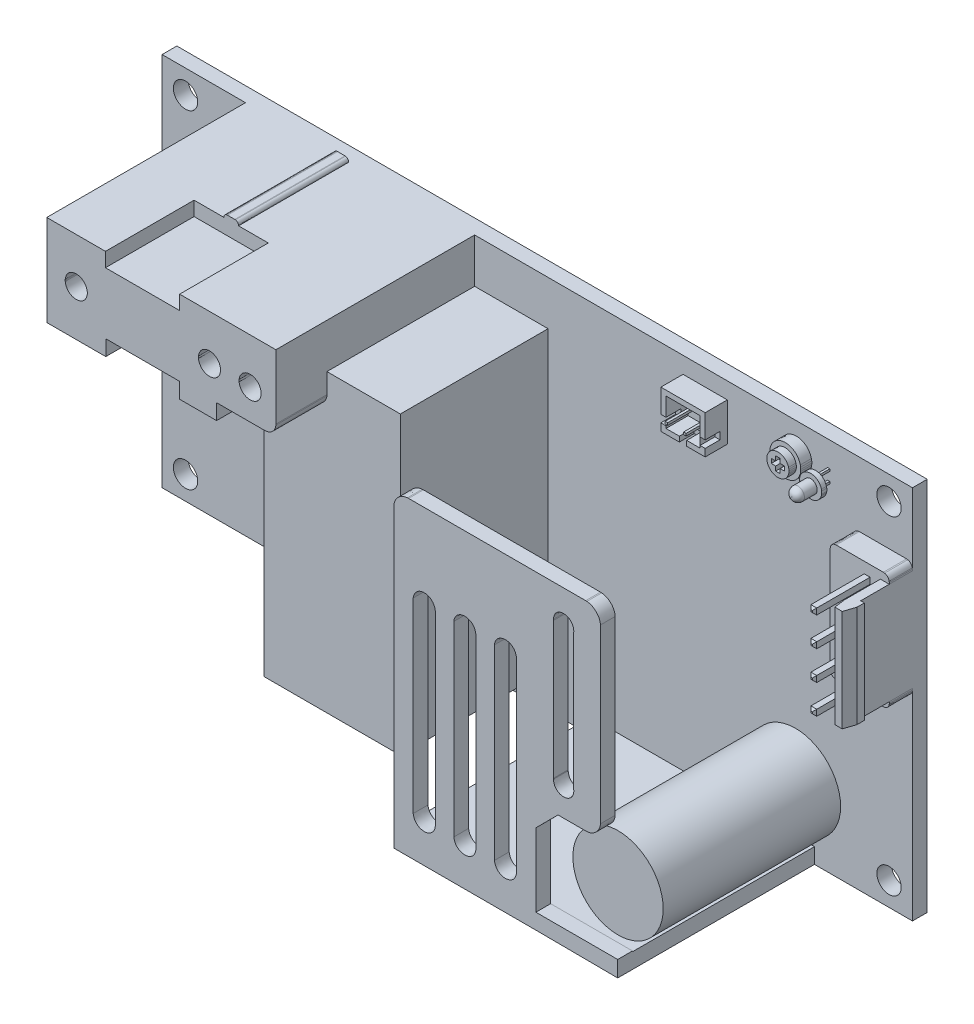
from build123d import *

# Parameters (mm, degrees)
MODEL_W            = 101.6
MODEL_H            = 50.8
MODEL_R            = 1.65
EXTRUDE_951_DEPTH  = 2
EXTRUDE_3496_DEPTH = 8
EXTRUDE_1_DEPTH    = 1.5
EXTRUDE_2_DEPTH    = 2.5
EXTRUDE_START      = 1.76
EXTRUDE_1_2_DEPTH  = 0.68
SKETCH14_W         = 0.3
SKETCH14_H         = 0.3
EXTRUDE_4126_DEPTH = 6.02
SKETCH15_R         = 0.885
EXTRUDE_2_2_DEPTH  = 2.56
FILLET_3_R         = 0.83
CN1_DEPTH          = 3.27
SKETCH16_W         = 0.788697824
SKETCH16_H         = 0.829064995
SKETCH16_H_2       = 0.828989046
CN1_2_DEPTH        = 10.8
CN1_3_DEPTH        = 9.818754362
CN1_45_SIZE        = 0.3
CN2_DEPTH          = 3.14
SKETCH18_W         = 0.788811748
SKETCH18_H         = 0.828951071
SKETCH18_H_2       = 0.829064995
SKETCH18_H_3       = 0.82910297
CN2_2_DEPTH        = 10.66
CN2_45_SIZE        = 0.3
CN2_3_DEPTH        = 13.77610427
CN101_DEPTH        = 3
SKETCH20_W         = 0.334227269
SKETCH20_H         = 0.318000654
SKETCH20_W_2       = 0.334250054
CN101_2_DEPTH      = 4
SKETCH22_W         = 0.693798895
SKETCH22_H         = 0.992660269
SKETCH22_W_2       = 0.993040016
SKETCH22_H_2       = 0.693419147
SKETCH22_W_3       = 0.693419147
CN101_2_2_DEPTH    = 2
HS1_DEPTH          = 26.91
HS12_W             = 10.041048365
HS12_H             = 3.207380154
HS12_W_2           = 9.999514227
HS12_H_2           = 2.100384065
HS1_2_DEPTH        = 12
EXTRUDE19_DEPTH    = 26.64
SKETCH24_W         = 35.128538906
SKETCH24_H         = 24.64
EXTRUDE20_DEPTH    = 40
SKETCH10_R         = 6.116837053
EXTRUDE_7326_DEPTH = 24.02
EXTRUDE22_DEPTH    = 20


with BuildPart() as part:
    # Model → Extrude 951 (new body)
    with BuildSketch(Plane.XY):
        with Locations((50.8, 25.4)):
            Rectangle(MODEL_W, MODEL_H)
        with Locations((3.175, 47.625)):
            Circle(MODEL_R, mode=Mode.SUBTRACT)
        with Locations((3.175, 3.175)):
            Circle(MODEL_R, mode=Mode.SUBTRACT)
        with Locations((98.425, 3.175)):
            Circle(MODEL_R, mode=Mode.SUBTRACT)
        with Locations((98.425, 47.625)):
            Circle(MODEL_R, mode=Mode.SUBTRACT)
    extrude(amount=-EXTRUDE_951_DEPTH)

    # Sketch3 → Extrude 3496 (add)
    with BuildSketch(Plane.XY):
        with BuildLine():
            add(Edge.make_bspline(
                [(13.62154699, 24.750430627), (13.616990018, 24.750430627), (13.612433047, 24.750430627), (13.607876076, 24.750430627), (12.112050216, 24.750430627), (10.616224356, 24.750430627), (9.120398496, 24.750430627)],
                knots=[10, 10, 10, 10, 11, 11, 11, 12, 12, 12, 12], degree=3, weights=[1, 1, 1, 1, 1, 1, 1]))
            add(Edge.make_bspline(
                [(9.120398496, 24.750430627), (9.115841525, 24.750430627), (9.111284553, 24.750430627), (9.106727582, 24.750430627)],
                knots=[0, 0, 0, 0, 1, 1, 1, 1], degree=3, weights=[1, 1, 1, 1]))
            add(Edge.make_bspline(
                [(9.106727582, 24.750430627), (9.106727582, 24.754987599), (9.106727582, 24.75954457), (9.106727582, 24.764101542), (9.106727582, 27.588284563), (9.106727582, 30.412467584), (9.106727582, 33.236650605), (9.106727582, 33.245637965), (9.106727582, 33.254625325), (9.106727582, 33.263612685)],
                knots=[1, 1, 1, 1, 2, 2, 2, 3, 3, 3, 4, 4, 4, 4], degree=3, weights=[1, 1, 1, 1, 1, 1, 1, 1, 1, 1]))
            add(Edge.make_bspline(
                [(9.106727582, 33.263612685), (9.111284553, 33.263612685), (9.115841525, 33.263612685), (9.120398496, 33.263612685), (10.616224356, 33.263612685), (12.112050216, 33.263612685), (13.607876076, 33.263612685), (13.612433047, 33.263612685), (13.616990018, 33.263612685), (13.62154699, 33.263612685)],
                knots=[4, 4, 4, 4, 5, 5, 5, 6, 6, 6, 7, 7, 7, 7], degree=3, weights=[1, 1, 1, 1, 1, 1, 1, 1, 1, 1]))
            add(Edge.make_bspline(
                [(13.62154699, 33.263612685), (13.62154699, 33.254625325), (13.62154699, 33.245637965), (13.62154699, 33.236650605), (13.62154699, 30.412467584), (13.62154699, 27.588284563), (13.62154699, 24.764101542), (13.62154699, 24.75954457), (13.62154699, 24.754987599), (13.62154699, 24.750430627)],
                knots=[7, 7, 7, 7, 8, 8, 8, 9, 9, 9, 10, 10, 10, 10], degree=3, weights=[1, 1, 1, 1, 1, 1, 1, 1, 1, 1]))
        make_face()
        with BuildLine():
            add(Edge.make_bspline(
                [(0.231266298, 22.616249025), (0.239873911, 22.616249025), (0.248861271, 22.616249025), (0.257848631, 22.616249025), (3.082031652, 22.616249025), (5.906214673, 22.616249025), (8.730397694, 22.616249025), (8.734954666, 22.616249025), (8.739511637, 22.616249025), (8.744448356, 22.616249025)],
                knots=[0, 0, 0, 0, 1, 1, 1, 2, 2, 2, 3, 3, 3, 3], degree=3, weights=[1, 1, 1, 1, 1, 1, 1, 1, 1, 1]))
            add(Edge.make_bspline(
                [(8.744448356, 27.130688685), (8.744448356, 27.126131714), (8.744448356, 27.121574742), (8.744448356, 27.117017771), (8.744448356, 25.621191911), (8.744448356, 24.125366051), (8.744448356, 22.629540191), (8.744448356, 22.62498322), (8.744448356, 22.620426249), (8.744448356, 22.616249025)],
                knots=[6, 6, 6, 6, 7, 7, 7, 8, 8, 8, 9, 9, 9, 9], degree=3, weights=[1, 1, 1, 1, 1, 1, 1, 1, 1, 1]))
            add(Edge.make_bspline(
                [(0.231266298, 27.130688685), (0.240253658, 27.130688685), (0.249241019, 27.130688685), (0.258228379, 27.130688685), (3.0824114, 27.130688685), (5.906594421, 27.130688685), (8.730777442, 27.130688685), (8.735334413, 27.130688685), (8.739891385, 27.130688685), (8.744448356, 27.130688685)],
                knots=[3, 3, 3, 3, 4, 4, 4, 5, 5, 5, 6, 6, 6, 6], degree=3, weights=[1, 1, 1, 1, 1, 1, 1, 1, 1, 1]))
            add(Edge.make_bspline(
                [(0.231266298, 22.616249025), (0.231266298, 22.620426249), (0.231266298, 22.62498322), (0.231266298, 22.629540191), (0.231266298, 24.125366051), (0.231266298, 25.621191911), (0.231266298, 27.117017771), (0.231266298, 27.121574742), (0.231266298, 27.126131714), (0.231266298, 27.130688685)],
                knots=[0, 0, 0, 0, 1, 1, 1, 2, 2, 2, 3, 3, 3, 3], degree=3, weights=[1, 1, 1, 1, 1, 1, 1, 1, 1, 1]))
        make_face()
    extrude(amount=EXTRUDE_3496_DEPTH)

    # Sketch13 → Extrude 1 (add)
    with BuildSketch(Plane.XY):
        with BuildLine():
            add(Edge.make_bspline(
                [(87.960180824, 47.149084268), (87.946636492, 47.230603423), (87.93309216, 47.312122578), (87.919547829, 47.393641733)],
                knots=[7, 7, 7, 7, 8, 8, 8, 8], degree=3, weights=[1, 1, 1, 1]))
            add(Edge.make_bspline(
                [(87.919547829, 47.393641733), (87.298280729, 49.655798282), (84.141059049, 49.468962455), (83.798906446, 47.149084268)],
                knots=[0, 0, 0, 0, 1, 1, 1, 1], degree=3, weights=[1, 1, 1, 1]))
            add(Edge.make_bspline(
                [(83.798906446, 47.149084268), (83.794349475, 47.062881559), (83.789792504, 46.976678851), (83.785235532, 46.890476142)],
                knots=[1, 1, 1, 1, 2, 2, 2, 2], degree=3, weights=[1, 1, 1, 1]))
            add(Edge.make_bspline(
                [(83.785235532, 46.890476142), (83.789792504, 46.808956987), (83.794349475, 46.727437832), (83.798906446, 46.645918677)],
                knots=[2, 2, 2, 2, 3, 3, 3, 3], degree=3, weights=[1, 1, 1, 1]))
            add(Edge.make_bspline(
                [(83.798906446, 46.645918677), (84.106122268, 44.327559481), (87.315369372, 44.133128701), (87.919547829, 46.38731055)],
                knots=[3, 3, 3, 3, 4, 4, 4, 4], degree=3, weights=[1, 1, 1, 1]))
            add(Edge.make_bspline(
                [(87.919547829, 46.38731055), (87.93309216, 46.473513259), (87.946636492, 46.559715968), (87.960180824, 46.645918677)],
                knots=[4, 4, 4, 4, 5, 5, 5, 5], degree=3, weights=[1, 1, 1, 1]))
            add(Edge.make_bspline(
                [(87.960180824, 46.645918677), (87.964737795, 46.727437832), (87.969294767, 46.808956987), (87.973851738, 46.890476142)],
                knots=[5, 5, 5, 5, 6, 6, 6, 6], degree=3, weights=[1, 1, 1, 1]))
            add(Edge.make_bspline(
                [(87.973851738, 46.890476142), (87.969294767, 46.976678851), (87.964737795, 47.062881559), (87.960180824, 47.149084268)],
                knots=[6, 6, 6, 6, 7, 7, 7, 7], degree=3, weights=[1, 1, 1, 1]))
        make_face()
    extrude(amount=EXTRUDE_1_DEPTH)

    # Sketch7 → Extrude 2 (add)
    with BuildSketch(Plane.XY):
        with BuildLine():
            add(Edge.make_bspline(
                [(87.362078328, 47.108071526), (87.348533997, 47.176046349), (87.334989665, 47.244021172), (87.321445333, 47.311995996)],
                knots=[7, 7, 7, 7, 8, 8, 8, 8], degree=3, weights=[1, 1, 1, 1]))
            add(Edge.make_bspline(
                [(87.321445333, 47.311995996), (86.822077218, 48.857948541), (84.670806973, 48.706429242), (84.397388689, 47.108071526)],
                knots=[0, 0, 0, 0, 1, 1, 1, 1], degree=3, weights=[1, 1, 1, 1]))
            add(Edge.make_bspline(
                [(84.397388689, 47.108071526), (84.392958301, 47.035539731), (84.388527912, 46.963007936), (84.384097523, 46.890476142)],
                knots=[1, 1, 1, 1, 2, 2, 2, 2], degree=3, weights=[1, 1, 1, 1]))
            add(Edge.make_bspline(
                [(84.384097523, 46.890476142), (84.388527912, 46.817944347), (84.392958301, 46.745412552), (84.397388689, 46.672880758)],
                knots=[2, 2, 2, 2, 3, 3, 3, 3], degree=3, weights=[1, 1, 1, 1]))
            add(Edge.make_bspline(
                [(84.397388689, 46.672880758), (84.672325963, 45.080978751), (86.820558228, 44.931737938), (87.321445333, 46.468956288)],
                knots=[3, 3, 3, 3, 4, 4, 4, 4], degree=3, weights=[1, 1, 1, 1]))
            add(Edge.make_bspline(
                [(87.321445333, 46.468956288), (87.334989665, 46.536931111), (87.348533997, 46.604905934), (87.362078328, 46.672880758)],
                knots=[4, 4, 4, 4, 5, 5, 5, 5], degree=3, weights=[1, 1, 1, 1]))
            add(Edge.make_bspline(
                [(87.362078328, 46.672880758), (87.3666353, 46.745412552), (87.371192271, 46.817944347), (87.375749243, 46.890476142)],
                knots=[5, 5, 5, 5, 6, 6, 6, 6], degree=3, weights=[1, 1, 1, 1]))
            add(Edge.make_bspline(
                [(87.375749243, 46.890476142), (87.371192271, 46.963007936), (87.3666353, 47.035539731), (87.362078328, 47.108071526)],
                knots=[6, 6, 6, 6, 7, 7, 7, 7], degree=3, weights=[1, 1, 1, 1]))
        make_face()
        Polygon((85.580682261, 47.787819759), (85.580682261, 47.189337516), (84.982200018, 47.189337516), (84.982200018, 46.59123502), (85.580682261, 46.59123502), (85.580682261, 45.992752777), (86.179164504, 45.992752777), (86.179164504, 46.59123502), (86.777267, 46.59123502), (86.777267, 47.189337516), (86.179164504, 47.189337516), (86.179164504, 47.787819759), align=None, mode=Mode.SUBTRACT)
    extrude(amount=EXTRUDE_2_DEPTH)



with BuildPart() as body_2:
    # Sketch8 → Extrude 1 2 (new body)
    with BuildSketch(Plane.XY.offset(EXTRUDE_START)):
        with BuildLine():
            add(Edge.make_bspline(
                [(91.754619004, 46.346297808), (91.74094809, 46.282753373), (91.727277176, 46.219208939), (91.713606261, 46.155664505)],
                knots=[7, 7, 7, 7, 8, 8, 8, 8], degree=3, weights=[1, 1, 1, 1]))
            add(Edge.make_bspline(
                [(91.713606261, 46.155664505), (91.180820356, 44.394395061), (88.708283627, 44.828446586), (88.762587537, 46.618197101)],
                knots=[0, 0, 0, 0, 1, 1, 1, 1], degree=3, weights=[1, 1, 1, 1]))
            add(Edge.make_bspline(
                [(88.762587537, 46.618197101), (88.767144508, 46.677184564), (88.771701479, 46.736172027), (88.776258451, 46.79515949)],
                knots=[1, 1, 1, 1, 2, 2, 2, 2], degree=3, weights=[1, 1, 1, 1]))
            add(Edge.make_bspline(
                [(88.776258451, 46.79515949), (88.789929365, 46.858577342), (88.803600279, 46.921995194), (88.817271193, 46.985413046)],
                knots=[2, 2, 2, 2, 3, 3, 3, 3], degree=3, weights=[1, 1, 1, 1]))
            add(Edge.make_bspline(
                [(88.817271193, 46.985413046), (89.339424165, 48.42959323), (91.297402874, 48.368453864), (91.713606261, 46.903767308)],
                knots=[3, 3, 3, 3, 4, 4, 4, 4], degree=3, weights=[1, 1, 1, 1]))
            add(Edge.make_bspline(
                [(91.713606261, 46.903767308), (91.727277176, 46.844779845), (91.74094809, 46.785792382), (91.754619004, 46.726804919)],
                knots=[4, 4, 4, 4, 5, 5, 5, 5], degree=3, weights=[1, 1, 1, 1]))
            add(Edge.make_bspline(
                [(91.754619004, 46.726804919), (91.754619004, 46.663387067), (91.754619004, 46.599969215), (91.754619004, 46.536551364), (91.754619004, 46.473133512), (91.754619004, 46.40971566), (91.754619004, 46.346297808)],
                knots=[5, 5, 5, 5, 6, 6, 6, 7, 7, 7, 7], degree=3, weights=[1, 1, 1, 1, 1, 1, 1]))
        make_face()
    extrude(amount=EXTRUDE_1_2_DEPTH)


with BuildPart() as part_1:
    add(part.part)

    add(body_2.part)  # Extrude 4126 merges body 2
    # Sketch14 → Extrude 4126 (add)
    with BuildSketch(Plane.XY.offset(2.44)):
        with Locations((90.258239122, 47.276551364)):
            Rectangle(SKETCH14_W, SKETCH14_H)
        with Locations((90.258239122, 45.796551364)):
            Rectangle(SKETCH14_W, SKETCH14_H)
    extrude(amount=-EXTRUDE_4126_DEPTH)

    # Sketch15 → Extrude 2 2 (add)
    with BuildSketch(Plane.XY.offset(2.44)):
        with Locations(Location((90.258239122, 46.536551364, 0), (0, 0, 180))):
            Circle(SKETCH15_R)
    extrude(amount=EXTRUDE_2_2_DEPTH)

    # светодиод-3
    fillet_3_edges = [part_1.edges().sort_by_distance(p)[0] for p in [
        (91.143239122, 46.536551364, 5),
    ]]
    fillet(fillet_3_edges, radius=FILLET_3_R)

    # Sketch2 → CN1 (add)
    with BuildSketch(Plane.XY):
        with BuildLine():
            Line((0.000379748, 28.816768101), (1.196964486, 28.816768101))
            Line((1.196964486, 28.816768101), (1.196964486, 38.635522463))
            Line((1.196964486, 38.635522463), (0.000379748, 38.635522463))
            Line((0.000379748, 38.635522463), (0.000379748, 38.825776018))
            add(Edge.make_bspline(
                [(0.014050662, 38.989067493), (0.00949369, 38.934637002), (0.004936719, 38.88020651), (0.000379748, 38.825776018)],
                knots=[9, 9, 9, 9, 10, 10, 10, 10], degree=3, weights=[1, 1, 1, 1]))
            add(Edge.make_bspline(
                [(0.639494986, 39.614511817), (0.35050705, 39.573878822), (0.054683657, 39.278055429), (0.014050662, 38.989067493)],
                knots=[8, 8, 8, 8, 9, 9, 9, 9], degree=3, weights=[1, 1, 1, 1]))
            add(Edge.make_bspline(
                [(0.80278646, 39.628182731), (0.748355969, 39.62362576), (0.693925477, 39.619068788), (0.639494986, 39.614511817)],
                knots=[7, 7, 7, 7, 8, 8, 8, 8], degree=3, weights=[1, 1, 1, 1]))
            add(Edge.make_bspline(
                [(7.194318587, 39.628182731), (5.063807878, 39.628182731), (2.933297169, 39.628182731), (0.80278646, 39.628182731)],
                knots=[6, 6, 6, 6, 7, 7, 7, 7], degree=3, weights=[1, 1, 1, 1]))
            add(Edge.make_bspline(
                [(7.357610062, 39.614511817), (7.30317957, 39.619068788), (7.248749079, 39.62362576), (7.194318587, 39.628182731)],
                knots=[5, 5, 5, 5, 6, 6, 6, 6], degree=3, weights=[1, 1, 1, 1]))
            add(Edge.make_bspline(
                [(7.983054386, 38.989067493), (7.942041643, 39.277675682), (7.646597998, 39.57425857), (7.357610062, 39.614511817)],
                knots=[4, 4, 4, 4, 5, 5, 5, 5], degree=3, weights=[1, 1, 1, 1]))
            add(Edge.make_bspline(
                [(7.9967253, 38.825776018), (7.992168329, 38.88020651), (7.987611357, 38.934637002), (7.983054386, 38.989067493)],
                knots=[3, 3, 3, 3, 4, 4, 4, 4], degree=3, weights=[1, 1, 1, 1]))
            add(Edge.make_bspline(
                [(7.9967253, 28.626514545), (7.9967253, 32.02626837), (7.9967253, 35.426022194), (7.9967253, 38.825776018)],
                knots=[2, 2, 2, 2, 3, 3, 3, 3], degree=3, weights=[1, 1, 1, 1]))
            add(Edge.make_bspline(
                [(7.983054386, 28.46322307), (7.987611357, 28.517653562), (7.992168329, 28.572084053), (7.9967253, 28.626514545)],
                knots=[1, 1, 1, 1, 2, 2, 2, 2], degree=3, weights=[1, 1, 1, 1]))
            add(Edge.make_bspline(
                [(7.357610062, 27.837778746), (7.646597998, 27.878411741), (7.942041643, 28.174235134), (7.983054386, 28.46322307)],
                knots=[0, 0, 0, 0, 1, 1, 1, 1], degree=3, weights=[1, 1, 1, 1]))
            add(Edge.make_bspline(
                [(7.194318587, 27.824107832), (7.248749079, 27.828664804), (7.30317957, 27.833221775), (7.357610062, 27.837778746)],
                knots=[15, 15, 15, 15, 16, 16, 16, 16], degree=3, weights=[1, 1, 1, 1]))
            add(Edge.make_bspline(
                [(0.80278646, 27.824107832), (2.933297169, 27.824107832), (5.063807878, 27.824107832), (7.194318587, 27.824107832)],
                knots=[14, 14, 14, 14, 15, 15, 15, 15], degree=3, weights=[1, 1, 1, 1]))
            add(Edge.make_bspline(
                [(0.639494986, 27.837778746), (0.693925477, 27.833221775), (0.748355969, 27.828664804), (0.80278646, 27.824107832)],
                knots=[13, 13, 13, 13, 14, 14, 14, 14], degree=3, weights=[1, 1, 1, 1]))
            add(Edge.make_bspline(
                [(0.014050662, 28.46322307), (0.054683657, 28.174235134), (0.35050705, 27.878411741), (0.639494986, 27.837778746)],
                knots=[12, 12, 12, 12, 13, 13, 13, 13], degree=3, weights=[1, 1, 1, 1]))
            add(Edge.make_bspline(
                [(0.000379748, 28.626514545), (0.004936719, 28.572084053), (0.00949369, 28.517653562), (0.014050662, 28.46322307)],
                knots=[11, 11, 11, 11, 12, 12, 12, 12], degree=3, weights=[1, 1, 1, 1]))
            Line((0.000379748, 28.626514545), (0.000379748, 28.816768101))
        make_face()
    extrude(amount=CN1_DEPTH)

    # Sketch16 → CN1 2 (add)
    with BuildSketch(Plane.XY):
        with Locations((2.998658063, 37.737950998)):
            Rectangle(SKETCH16_W, SKETCH16_H)
        with Locations((2.998658063, 29.707466134)):
            Rectangle(SKETCH16_W, SKETCH16_H_2)
    extrude(amount=CN1_2_DEPTH)

    # Sketch17 → CN1 3 (add)
    with BuildSketch(Plane(origin=(0, 28.816768101, 0), x_dir=(1, 0, 0), z_dir=(0, 1, 0))):
        Polygon((0, 0), (1.2, 0), (1.2, -8), (1, -9.51), (0, -9.51), (-0.5, -8), (-0.5, -7), (0, -7), align=None)
    extrude(amount=CN1_3_DEPTH)

    # CN1 ногих45
    cn1_45_edges = [part_1.edges().sort_by_distance(p)[0] for p in [
        (2.604309151, 37.737950997, 10.8),
        (2.998658063, 37.3234185, 10.8),
        (3.393006975, 37.737950997, 10.8),
        (2.998658063, 38.152483495, 10.8),
        (2.604309151, 29.707466134, 10.8),
        (2.998658063, 29.292971611, 10.8),
        (3.393006975, 29.707466134, 10.8),
        (2.998658063, 30.121960657, 10.8),
    ]]
    chamfer(cn1_45_edges, length=CN1_45_SIZE)

    # Sketch9 → CN2 (add)
    with BuildSketch(Plane.XY):
        with BuildLine():
            Line((101.599955699, 27.279929498), (100.403295011, 27.279929498))
            Line((100.403295011, 27.279929498), (100.403295011, 41.056033768))
            Line((100.403295011, 41.056033768), (101.599955699, 41.056033768))
            Line((101.599955699, 41.056033768), (101.600335447, 41.259958238))
            add(Edge.make_bspline(
                [(101.600335447, 41.259958238), (101.595778475, 41.309831758), (101.591221504, 41.359705278), (101.586664533, 41.409578798)],
                knots=[1, 1, 1, 1, 2, 2, 2, 2], degree=3, weights=[1, 1, 1, 1]))
            add(Edge.make_bspline(
                [(101.586664533, 41.409578798), (101.544512547, 41.689073044), (101.260841078, 42.005782556), (100.961220209, 42.035023122)],
                knots=[2, 2, 2, 2, 3, 3, 3, 3], degree=3, weights=[1, 1, 1, 1]))
            add(Edge.make_bspline(
                [(100.961220209, 42.035023122), (100.906789717, 42.044137065), (100.852359226, 42.053251008), (100.797928734, 42.062364951)],
                knots=[3, 3, 3, 3, 4, 4, 4, 4], degree=3, weights=[1, 1, 1, 1]))
            add(Edge.make_bspline(
                [(100.797928734, 42.062364951), (98.66767119, 42.062364951), (96.537033899, 42.062364951), (94.406396607, 42.062364951)],
                knots=[0, 0, 0, 0, 1, 1, 1, 1], degree=3, weights=[1, 1, 1, 1]))
            add(Edge.make_bspline(
                [(94.406396607, 42.062364951), (94.352092698, 42.05337759), (94.297788789, 42.04439023), (94.24348488, 42.03540287)],
                knots=[1, 1, 1, 1, 2, 2, 2, 2], degree=3, weights=[1, 1, 1, 1]))
            add(Edge.make_bspline(
                [(94.24348488, 42.03540287), (93.943104516, 42.005402808), (93.660952037, 41.689832539), (93.617660809, 41.409578798)],
                knots=[2, 2, 2, 2, 3, 3, 3, 3], degree=3, weights=[1, 1, 1, 1]))
            add(Edge.make_bspline(
                [(93.617660809, 41.409578798), (93.613103837, 41.359705278), (93.608546866, 41.309831758), (93.603989894, 41.259958238)],
                knots=[3, 3, 3, 3, 4, 4, 4, 4], degree=3, weights=[1, 1, 1, 1]))
            add(Edge.make_bspline(
                [(93.603989894, 41.259958238), (93.603989894, 36.536783971), (93.603989894, 31.813229957), (93.603989894, 27.089675943)],
                knots=[0, 0, 0, 0, 1, 1, 1, 1], degree=3, weights=[1, 1, 1, 1]))
            add(Edge.make_bspline(
                [(93.603989894, 27.089675943), (93.608546866, 27.035245451), (93.613103837, 26.980814959), (93.617660809, 26.926384468)],
                knots=[1, 1, 1, 1, 2, 2, 2, 2], degree=3, weights=[1, 1, 1, 1]))
            add(Edge.make_bspline(
                [(93.617660809, 26.926384468), (93.658673551, 26.637016784), (93.953737449, 26.341573139), (94.243105132, 26.300940144)],
                knots=[2, 2, 2, 2, 3, 3, 3, 3], degree=3, weights=[1, 1, 1, 1]))
            add(Edge.make_bspline(
                [(94.243105132, 26.300940144), (94.297535624, 26.296383173), (94.351966116, 26.291826201), (94.40601686, 26.28726923)],
                knots=[3, 3, 3, 3, 4, 4, 4, 4], degree=3, weights=[1, 1, 1, 1]))
            add(Edge.make_bspline(
                [(94.40601686, 26.28726923), (96.536654151, 26.28726923), (98.667291442, 26.28726923), (100.797928734, 26.28726923)],
                knots=[0, 0, 0, 0, 1, 1, 1, 1], degree=3, weights=[1, 1, 1, 1]))
            add(Edge.make_bspline(
                [(100.797928734, 26.28726923), (100.852359226, 26.291826201), (100.906789717, 26.296383173), (100.961220209, 26.300940144)],
                knots=[1, 1, 1, 1, 2, 2, 2, 2], degree=3, weights=[1, 1, 1, 1]))
            add(Edge.make_bspline(
                [(100.961220209, 26.300940144), (101.249828397, 26.341573139), (101.546031538, 26.637396532), (101.586664533, 26.926384468)],
                knots=[2, 2, 2, 2, 3, 3, 3, 3], degree=3, weights=[1, 1, 1, 1]))
            add(Edge.make_bspline(
                [(101.586664533, 26.926384468), (101.591221504, 26.980814959), (101.595778475, 27.035245451), (101.600335447, 27.089675943)],
                knots=[3, 3, 3, 3, 4, 4, 4, 4], degree=3, weights=[1, 1, 1, 1]))
            Line((101.600335447, 27.089675943), (101.599955699, 27.279929498))
        make_face()
    extrude(amount=CN2_DEPTH)

    # Sketch18 → CN2 2 (add)
    with BuildSketch(Plane.XY):
        with Locations((98.601696371, 40.165354722)):
            Rectangle(SKETCH18_W, SKETCH18_H)
        with Locations((98.601696371, 36.208707348)):
            Rectangle(SKETCH18_W, SKETCH18_H_2)
        with Locations((98.601696371, 32.2517182)):
            Rectangle(SKETCH18_W, SKETCH18_H_3)
        with Locations((98.601696371, 28.29482399)):
            Rectangle(SKETCH18_W, SKETCH18_H)
    extrude(amount=CN2_2_DEPTH)

    # CN2 ногих45
    cn2_45_edges = [part_1.edges().sort_by_distance(p)[0] for p in [
        (98.207290497, 40.165354722, 10.66),
        (98.601696371, 39.750879186, 10.66),
        (98.996102245, 40.165354722, 10.66),
        (98.601696371, 40.579830257, 10.66),
        (98.207290497, 36.208707347, 10.66),
        (98.601696371, 35.79417485, 10.66),
        (98.996102245, 36.208707347, 10.66),
        (98.601696371, 36.623239845, 10.66),
        (98.207290497, 32.2517182, 10.66),
        (98.601696371, 31.837166715, 10.66),
        (98.996102245, 32.2517182, 10.66),
        (98.601696371, 32.666269685, 10.66),
        (98.207290497, 28.29482399, 10.66),
        (98.601696371, 27.880348454, 10.66),
        (98.996102245, 28.29482399, 10.66),
        (98.601696371, 28.709299525, 10.66),
    ]]
    chamfer(cn2_45_edges, length=CN2_45_SIZE)

    # Sketch19 → CN2 3 (add)
    with BuildSketch(Plane.XZ.offset(-41.056033768)):
        Polygon((101.6, 7.01), (102.1, 7.01), (102.1, 8.01), (101.6, 9.51), (100.6, 9.51), (100.4, 8.01), (100.4, 0), (101.6, 0), align=None)
    extrude(amount=CN2_3_DEPTH)

    # Sketch6 → CN101 (add)
    with BuildSketch(Plane.XY):
        Polygon((70.532803225, 48.5697201), (76.530157327, 48.5697201), (76.530157327, 43.374772712), (74.028000284, 43.375152459), (73.034960268, 43.375152459), (70.532803225, 43.374772712), align=None)
        Polygon((73.034960268, 44.068571606), (74.028000284, 44.068571606), (75.836358432, 44.068571606), (75.836358432, 47.876300953), (72.531794677, 47.876300953), (71.22660212, 47.876300953), (71.22660212, 44.068571606), align=None, mode=Mode.SUBTRACT)
    extrude(amount=CN101_DEPTH)

    # Sketch20 → CN101 2 (add)
    with BuildSketch(Plane.XY):
        with Locations((72.285693538, 45.693777479)):
            Rectangle(SKETCH20_W, SKETCH20_H)
        with Locations((74.782522721, 45.693777479)):
            Rectangle(SKETCH20_W_2, SKETCH20_H)
    extrude(amount=CN101_2_DEPTH)

    # Sketch22 → CN101 _2 2 (cut)
    with BuildSketch(Plane.XY.offset(3)):
        with Locations((70.879702673, 44.877813777)):
            Rectangle(SKETCH22_W, SKETCH22_H)
        with Locations((73.531480276, 43.721862033)):
            Rectangle(SKETCH22_W_2, SKETCH22_H_2)
        with Locations((76.183447754, 44.877813777)):
            Rectangle(SKETCH22_W_3, SKETCH22_H)
    extrude(amount=-CN101_2_2_DEPTH, mode=Mode.SUBTRACT)

    # Sketch4 → HS1 (add)
    with BuildSketch(Plane.XY):
        with BuildLine():
            Line((42.318314844, 42.082871322), (42.318314844, 48.77516356))
            Line((42.318314844, 48.77516356), (42.318314844, 48.875796679))
            Line((42.318314844, 48.875796679), (42.318314844, 50.8))
            Line((42.318314844, 50.8), (25.263654716, 50.8))
            add(Edge.make_bspline(
                [(25.263654716, 50.8), (25.26036357, 50.826835498), (25.257072424, 50.853670996), (25.253781278, 50.880506495)],
                knots=[0, 0, 0, 0, 1, 1, 1, 1], degree=3, weights=[1, 1, 1, 1]))
            add(Edge.make_bspline(
                [(25.253781278, 50.880506495), (25.226059702, 51.076076517), (25.046439079, 51.29063392), (24.841755114, 51.292532658)],
                knots=[1, 1, 1, 1, 2, 2, 2, 2], degree=3, weights=[1, 1, 1, 1]))
            add(Edge.make_bspline(
                [(24.841755114, 51.292532658), (24.814919616, 51.295950387), (24.788084118, 51.299368115), (24.76124862, 51.302406096)],
                knots=[2, 2, 2, 2, 3, 3, 3, 3], degree=3, weights=[1, 1, 1, 1]))
            Line((24.76124862, 51.302406096), (23.766309866, 51.302406096))
            add(Edge.make_bspline(
                [(23.766309866, 51.302406096), (23.73960095, 51.299368115), (23.712892034, 51.295950387), (23.686183119, 51.292532658)],
                knots=[0, 0, 0, 0, 1, 1, 1, 1], degree=3, weights=[1, 1, 1, 1]))
            add(Edge.make_bspline(
                [(23.686183119, 51.292532658), (23.499727039, 51.299368115), (23.26694175, 51.067342322), (23.273777207, 50.880506495)],
                knots=[1, 1, 1, 1, 2, 2, 2, 2], degree=3, weights=[1, 1, 1, 1]))
            add(Edge.make_bspline(
                [(23.273777207, 50.880506495), (23.270486061, 50.853670996), (23.267194915, 50.826835498), (23.263903769, 50.8)],
                knots=[2, 2, 2, 2, 3, 3, 3, 3], degree=3, weights=[1, 1, 1, 1]))
            Line((23.263903769, 50.8), (19.284723189, 50.8))
            Line((19.284723189, 50.8), (11.295046005, 50.8))
            Line((11.295046005, 50.8), (11.295046005, 40.582255174))
            Line((11.295046005, 40.582255174), (11.295213094, 40.474640168))
            Line((11.295213094, 40.474640168), (11.295213094, 38.474889221))
            Line((11.295213094, 38.474889221), (12.290151848, 38.474889221))
            Line((12.290151848, 38.474889221), (29.284237416, 38.474889221))
            Line((29.284237416, 38.474889221), (33.284119057, 38.474889221))
            Line((33.284119057, 38.474889221), (34.288931249, 38.474889221))
            Line((34.288931249, 38.474889221), (34.288931249, 40.474640168))
            Line((34.288931249, 40.474640168), (34.288931249, 40.575273286))
            Line((34.288931249, 40.575273286), (40.821349741, 40.575273286))
            Line((40.821349741, 40.575273286), (40.961856359, 40.585146724))
            ThreePointArc((40.961856359, 40.585146724), (41.884429518, 41.019411798), (42.318694591, 41.941984956))
            Line((42.318694591, 41.941984956), (42.318314844, 42.082871322))
        make_face()
        with BuildLine():
            add(Edge.make_bspline(
                [(37.334127382, 44.815914915), (37.334127382, 44.769079376), (37.334127382, 44.722243836), (37.334127382, 44.675408297), (37.334127382, 44.631863904), (37.334127382, 44.58831951), (37.334127382, 44.544775117)],
                knots=[4, 4, 4, 4, 5, 5, 5, 6, 6, 6, 6], degree=3, weights=[1, 1, 1, 1, 1, 1, 1]))
            add(Edge.make_bspline(
                [(37.334127382, 44.544775117), (37.565773428, 42.730720755), (40.09831028, 42.728822017), (40.318943645, 44.544775117)],
                knots=[0, 0, 0, 0, 1, 1, 1, 1], degree=3, weights=[1, 1, 1, 1]))
            add(Edge.make_bspline(
                [(40.318943645, 44.544775117), (40.322234791, 44.58831951), (40.325525937, 44.631863904), (40.328817083, 44.675408297)],
                knots=[1, 1, 1, 1, 2, 2, 2, 2], degree=3, weights=[1, 1, 1, 1]))
            add(Edge.make_bspline(
                [(40.328817083, 44.675408297), (40.325525937, 44.722243836), (40.322234791, 44.769079376), (40.318943645, 44.815914915)],
                knots=[2, 2, 2, 2, 3, 3, 3, 3], degree=3, weights=[1, 1, 1, 1]))
            add(Edge.make_bspline(
                [(40.318943645, 44.815914915), (40.087297599, 46.628070539), (37.580963333, 46.633007258), (37.334127382, 44.815914915)],
                knots=[3, 3, 3, 3, 4, 4, 4, 4], degree=3, weights=[1, 1, 1, 1]))
        make_face(mode=Mode.SUBTRACT)
        with BuildLine():
            add(Edge.make_bspline(
                [(13.787496698, 44.675408297), (13.790787844, 44.631863904), (13.79407899, 44.58831951), (13.797370136, 44.544775117)],
                knots=[5, 5, 5, 5, 6, 6, 6, 6], degree=3, weights=[1, 1, 1, 1]))
            add(Edge.make_bspline(
                [(13.797370136, 44.544775117), (14.018383249, 42.728822017), (16.550540353, 42.730720755), (16.782566146, 44.544775117)],
                knots=[0, 0, 0, 0, 1, 1, 1, 1], degree=3, weights=[1, 1, 1, 1]))
            add(Edge.make_bspline(
                [(16.782566146, 44.544775117), (16.782566146, 44.58831951), (16.782566146, 44.631863904), (16.782566146, 44.675408297), (16.782566146, 44.722243836), (16.782566146, 44.769079376), (16.782566146, 44.815914915)],
                knots=[1, 1, 1, 1, 2, 2, 2, 3, 3, 3, 3], degree=3, weights=[1, 1, 1, 1, 1, 1, 1]))
            add(Edge.make_bspline(
                [(16.782566146, 44.815914915), (16.536489691, 46.63110852), (14.03091492, 46.630349025), (13.797370136, 44.815914915)],
                knots=[3, 3, 3, 3, 4, 4, 4, 4], degree=3, weights=[1, 1, 1, 1]))
            add(Edge.make_bspline(
                [(13.797370136, 44.815914915), (13.79407899, 44.769079376), (13.790787844, 44.722243836), (13.787496698, 44.675408297)],
                knots=[4, 4, 4, 4, 5, 5, 5, 5], degree=3, weights=[1, 1, 1, 1]))
        make_face(mode=Mode.SUBTRACT)
        with BuildLine():
            add(Edge.make_bspline(
                [(31.836900892, 44.815914915), (31.836900892, 44.769079376), (31.836900892, 44.722243836), (31.836900892, 44.675408297), (31.836900892, 44.631863904), (31.836900892, 44.58831951), (31.836900892, 44.544775117)],
                knots=[4, 4, 4, 4, 5, 5, 5, 6, 6, 6, 6], degree=3, weights=[1, 1, 1, 1, 1, 1, 1]))
            add(Edge.make_bspline(
                [(31.836900892, 44.544775117), (32.068546937, 42.730720755), (34.601083789, 42.728822017), (34.821717154, 44.544775117)],
                knots=[0, 0, 0, 0, 1, 1, 1, 1], degree=3, weights=[1, 1, 1, 1]))
            add(Edge.make_bspline(
                [(34.821717154, 44.544775117), (34.8250083, 44.58831951), (34.828299446, 44.631863904), (34.831590592, 44.675408297)],
                knots=[1, 1, 1, 1, 2, 2, 2, 2], degree=3, weights=[1, 1, 1, 1]))
            add(Edge.make_bspline(
                [(34.831590592, 44.675408297), (34.828299446, 44.722243836), (34.8250083, 44.769079376), (34.821717154, 44.815914915)],
                knots=[2, 2, 2, 2, 3, 3, 3, 3], degree=3, weights=[1, 1, 1, 1]))
            add(Edge.make_bspline(
                [(34.821717154, 44.815914915), (34.589311613, 46.629209782), (32.082977347, 46.632247763), (31.836900892, 44.815914915)],
                knots=[3, 3, 3, 3, 4, 4, 4, 4], degree=3, weights=[1, 1, 1, 1]))
        make_face(mode=Mode.SUBTRACT)
    extrude(amount=HS1_DEPTH)

    # HS12 → HS1 _2 (cut)
    with BuildSketch(Plane.XY.offset(26.91)):
        with Locations((24.263713234, 50.479866503)):
            Rectangle(HS12_W, HS12_H)
        with Locations((24.284480303, 39.525081254)):
            Rectangle(HS12_W_2, HS12_H_2)
    extrude(amount=-HS1_2_DEPTH, mode=Mode.SUBTRACT)

    # Sketch12 → Extrude19 (add)
    with BuildSketch(Plane.XY):
        with BuildLine():
            Line((83.994856216, 15.078258845), (80.246367498, 15.078258845))
            Line((80.246367498, 15.078258845), (77.251677797, 12.072936211))
            Line((77.251677797, 12.072936211), (77.251677797, 2.174055102))
            Line((77.251677797, 2.174055102), (88.328051691, 2.174055102))
            Line((88.328051691, 2.174055102), (88.328051691, 0))
            Line((88.328051691, 0), (77.251677797, 0.073671038))
            Line((77.251677797, 0.073671038), (58.016701546, 0.075190028))
            add(Edge.make_bspline(
                [(58.016701546, 40.233880179), (58.016701546, 40.183626911), (58.016701546, 40.133373643), (58.016701546, 40.083120375), (58.016701546, 27.447271614), (58.016701546, 14.811422854), (58.016701546, 2.175574093), (58.016701546, 2.142156302), (58.016701546, 2.108738512), (58.016701546, 2.075320722), (58.016701546, 1.408610491), (58.016701546, 0.741900259), (58.016701546, 0.075190028)],
                knots=[2, 2, 2, 2, 3, 3, 3, 4, 4, 4, 5, 5, 5, 6, 6, 6, 6], degree=3, weights=[1, 1, 1, 1, 1, 1, 1, 1, 1, 1, 1, 1, 1]))
            add(Edge.make_bspline(
                [(59.855819251, 42.072997884), (58.891640054, 42.010339527), (58.080119398, 41.197679629), (58.016701546, 40.233880179)],
                knots=[1, 1, 1, 1, 2, 2, 2, 2], degree=3, weights=[1, 1, 1, 1]))
            Line((59.855819251, 42.072997884), (60.016452492, 42.081732079))
            Line((60.016452492, 42.081732079), (83.994856216, 42.081732079))
            Line((83.994856216, 42.081732079), (84.155869206, 42.071478893))
            add(Edge.make_bspline(
                [(85.99498691, 40.232361189), (85.93612603, 41.188565686), (85.113972441, 42.016035741), (84.155869206, 42.071478893)],
                knots=[1, 1, 1, 1, 2, 2, 2, 2], degree=3, weights=[1, 1, 1, 1]))
            Line((85.99498691, 40.232361189), (85.99498691, 40.081981133))
            Line((85.99498691, 40.081981133), (85.99498691, 17.078009792))
            Line((85.99498691, 17.078009792), (85.99498691, 16.916617055))
            add(Edge.make_bspline(
                [(84.155489458, 15.087372788), (85.112833198, 15.134081745), (85.928910825, 15.965729024), (85.99498691, 16.916617055)],
                knots=[1, 1, 1, 1, 2, 2, 2, 2], degree=3, weights=[1, 1, 1, 1]))
            Line((84.155489458, 15.087372788), (83.994856216, 15.078258845))
        make_face()
        with BuildLine():
            Line((66.136844821, 30.576138806), (66.136844821, 5.582289957))
            Line((66.136844821, 5.582289957), (66.136844821, 5.440264348))
            add(Edge.make_bspline(
                [(66.136844821, 5.440264348), (66.359756672, 3.630766958), (68.910901157, 3.629627715), (69.121661084, 5.440264348)],
                knots=[1, 1, 1, 1, 2, 2, 2, 2], degree=3, weights=[1, 1, 1, 1]))
            Line((69.121661084, 5.440264348), (69.131534522, 5.580770966))
            Line((69.131534522, 5.580770966), (69.131534522, 30.574619816))
            Line((69.131534522, 30.574619816), (69.121661084, 30.715126434))
            add(Edge.make_bspline(
                [(69.121661084, 30.715126434), (68.907863176, 32.52538332), (66.362035158, 32.523484582), (66.136844821, 30.715126434)],
                knots=[1, 1, 1, 1, 2, 2, 2, 2], degree=3, weights=[1, 1, 1, 1]))
            Line((66.136844821, 30.715126434), (66.136844821, 30.576138806))
        make_face(mode=Mode.SUBTRACT)
        with BuildLine():
            Line((74.628761013, 5.580391219), (74.628761013, 30.574619816))
            add(Edge.make_bspline(
                [(74.628761013, 30.574619816), (74.625469867, 30.621455355), (74.622178721, 30.668290894), (74.618887575, 30.715126434)],
                knots=[0, 0, 0, 0, 1, 1, 1, 1], degree=3, weights=[1, 1, 1, 1]))
            add(Edge.make_bspline(
                [(74.618887575, 30.715126434), (74.404709919, 32.52538332), (71.859641396, 32.523864329), (71.633691564, 30.715126434)],
                knots=[1, 1, 1, 1, 2, 2, 2, 2], degree=3, weights=[1, 1, 1, 1]))
            add(Edge.make_bspline(
                [(71.633691564, 30.715126434), (71.633691564, 30.668290894), (71.633691564, 30.621455355), (71.633691564, 30.574619816)],
                knots=[2, 2, 2, 2, 3, 3, 3, 3], degree=3, weights=[1, 1, 1, 1]))
            Line((71.633691564, 30.574619816), (71.633691564, 5.580391219))
            add(Edge.make_bspline(
                [(71.633691564, 5.580391219), (71.633691564, 5.533555679), (71.633691564, 5.48672014), (71.633691564, 5.439884601)],
                knots=[0, 0, 0, 0, 1, 1, 1, 1], degree=3, weights=[1, 1, 1, 1]))
            add(Edge.make_bspline(
                [(71.633691564, 5.439884601), (71.85736291, 3.630007462), (74.407368152, 3.629247967), (74.618507827, 5.439884601)],
                knots=[1, 1, 1, 1, 2, 2, 2, 2], degree=3, weights=[1, 1, 1, 1]))
            add(Edge.make_bspline(
                [(74.618507827, 5.439884601), (74.621925556, 5.48672014), (74.625343284, 5.533555679), (74.628761013, 5.580391219)],
                knots=[2, 2, 2, 2, 3, 3, 3, 3], degree=3, weights=[1, 1, 1, 1]))
        make_face(mode=Mode.SUBTRACT)
        with BuildLine():
            Line((79.633454845, 37.579444342), (79.633454845, 19.07738099))
            add(Edge.make_bspline(
                [(79.633454845, 19.07738099), (79.630037117, 19.033836597), (79.626619388, 18.990292204), (79.62320166, 18.94674781)],
                knots=[0, 0, 0, 0, 1, 1, 1, 1], degree=3, weights=[1, 1, 1, 1]))
            add(Edge.make_bspline(
                [(79.62320166, 18.94674781), (79.733328468, 17.127376982), (82.276118506, 17.120541525), (82.38700481, 18.94674781)],
                knots=[1, 1, 1, 1, 2, 2, 2, 2], degree=3, weights=[1, 1, 1, 1]))
            add(Edge.make_bspline(
                [(82.38700481, 18.94674781), (82.383587081, 18.990292204), (82.380169353, 19.033836597), (82.376751624, 19.07738099)],
                knots=[2, 2, 2, 2, 3, 3, 3, 3], degree=3, weights=[1, 1, 1, 1]))
            add(Edge.make_bspline(
                [(82.376751624, 19.07738099), (82.377131372, 25.244862024), (82.377131372, 31.411963309), (82.377131372, 37.579064595)],
                knots=[0, 0, 0, 0, 1, 1, 1, 1], degree=3, weights=[1, 1, 1, 1]))
            add(Edge.make_bspline(
                [(82.377131372, 37.579064595), (82.3805491, 37.622608988), (82.383966829, 37.666153381), (82.387384557, 37.709697775)],
                knots=[1, 1, 1, 1, 2, 2, 2, 2], degree=3, weights=[1, 1, 1, 1]))
            add(Edge.make_bspline(
                [(82.387384557, 37.709697775), (82.276498253, 39.535904061), (79.733328468, 39.529068603), (79.623581407, 37.709697775)],
                knots=[2, 2, 2, 2, 3, 3, 3, 3], degree=3, weights=[1, 1, 1, 1]))
            add(Edge.make_bspline(
                [(79.623581407, 37.709697775), (79.626999136, 37.666153381), (79.630416864, 37.622608988), (79.633454845, 37.579444342)],
                knots=[3, 3, 3, 3, 4, 4, 4, 4], degree=3, weights=[1, 1, 1, 1]))
        make_face(mode=Mode.SUBTRACT)
        with BuildLine():
            add(Edge.make_bspline(
                [(60.639618331, 30.716645424), (60.639618331, 30.669809885), (60.639618331, 30.622974345), (60.639618331, 30.576138806), (60.639618331, 22.244855856), (60.639618331, 13.913572907), (60.639618331, 5.582289957), (60.639618331, 5.535454417), (60.639618331, 5.488618878), (60.639618331, 5.441783339)],
                knots=[5, 5, 5, 5, 6, 6, 6, 7, 7, 7, 8, 8, 8, 8], degree=3, weights=[1, 1, 1, 1, 1, 1, 1, 1, 1, 1]))
            add(Edge.make_bspline(
                [(60.639618331, 5.441783339), (60.886834029, 3.625070743), (63.38595309, 3.629247967), (63.634308031, 5.441783339)],
                knots=[0, 0, 0, 0, 1, 1, 1, 1], degree=3, weights=[1, 1, 1, 1]))
            add(Edge.make_bspline(
                [(63.634308031, 5.441783339), (63.634308031, 5.488618878), (63.634308031, 5.535454417), (63.634308031, 5.582289957), (63.634308031, 13.913572907), (63.634308031, 22.244855856), (63.634308031, 30.576138806), (63.634308031, 30.622974345), (63.634308031, 30.669809885), (63.634308031, 30.716645424)],
                knots=[1, 1, 1, 1, 2, 2, 2, 3, 3, 3, 4, 4, 4, 4], degree=3, weights=[1, 1, 1, 1, 1, 1, 1, 1, 1, 1]))
            add(Edge.make_bspline(
                [(63.634308031, 30.716645424), (63.381396119, 32.529180796), (60.890631505, 32.532978272), (60.639618331, 30.716645424)],
                knots=[4, 4, 4, 4, 5, 5, 5, 5], degree=3, weights=[1, 1, 1, 1]))
        make_face(mode=Mode.SUBTRACT)
    extrude(amount=EXTRUDE19_DEPTH)

    # Sketch24 → Extrude20 (cut)
    with BuildSketch(Plane(origin=(0, 42.081732079, 0), x_dir=(1, 0, 0), z_dir=(0, 1, 0))):
        with Locations((74.711538832, -12.32)):
            Rectangle(SKETCH24_W, SKETCH24_H)
    extrude(amount=-EXTRUDE20_DEPTH, mode=Mode.SUBTRACT)

    # Sketch10 → Extrude 7326 (add)
    with BuildSketch(Plane.XY):
        with Locations((85.75340608, 8.564565521)):
            Circle(SKETCH10_R)
    extrude(amount=EXTRUDE_7326_DEPTH)

    # Sketch5 → Extrude22 (add)
    with BuildSketch(Plane.XY):
        with BuildLine():
            Line((33.786525153, 38.474889221), (36.289061943, 40.575273286))
            Line((36.289061943, 40.575273286), (42.318694591, 44.782497125))
            add(Edge.make_bspline(
                [(42.318694591, 44.782497125), (42.924645204, 44.782497125), (43.530595817, 44.782497125), (44.13654643, 44.782497125), (46.840349456, 44.782497125), (49.544532231, 44.782497125), (52.248715005, 44.782497125), (52.253145394, 44.782497125), (52.257575783, 44.782497125), (52.261626424, 44.782497125)],
                knots=[0, 0, 0, 0, 1, 1, 1, 2, 2, 2, 3, 3, 3, 3], degree=3, weights=[1, 1, 1, 1, 1, 1, 1, 1, 1, 1]))
            add(Edge.make_bspline(
                [(52.261626424, 4.75975662), (52.261626424, 4.764693339), (52.261626424, 4.769250311), (52.261626424, 4.773807282), (52.261626424, 18.105606841), (52.261626424, 31.437406399), (52.261626424, 44.769205958), (52.261626424, 44.77376293), (52.261626424, 44.778319901), (52.261626424, 44.782497125)],
                knots=[0, 0, 0, 0, 1, 1, 1, 2, 2, 2, 3, 3, 3, 3], degree=3, weights=[1, 1, 1, 1, 1, 1, 1, 1, 1, 1]))
            add(Edge.make_bspline(
                [(33.767158024, 4.75975662), (33.771714996, 4.75975662), (33.776271967, 4.75975662), (33.780828938, 4.75975662), (39.936537796, 4.75975662), (46.0926264, 4.75975662), (52.248335257, 4.75975662), (52.252892229, 4.75975662), (52.2574492, 4.75975662), (52.261626424, 4.75975662)],
                knots=[0, 0, 0, 0, 1, 1, 1, 2, 2, 2, 3, 3, 3, 3], degree=3, weights=[1, 1, 1, 1, 1, 1, 1, 1, 1, 1]))
            Line((33.767158024, 4.75975662), (33.786525153, 4.838364377))
            add(Edge.make_bspline(
                [(33.786525153, 38.474889221), (33.786525153, 38.253876109), (33.786525153, 38.032862996), (33.786525153, 37.811849883), (33.786525153, 26.823852611), (33.786525153, 15.836235087), (33.786525153, 4.848617562), (33.786525153, 4.845199834), (33.786525153, 4.841782105), (33.786525153, 4.838364377)],
                knots=[3, 3, 3, 3, 4, 4, 4, 5, 5, 5, 6, 6, 6, 6], degree=3, weights=[1, 1, 1, 1, 1, 1, 1, 1, 1, 1]))
        make_face()
    extrude(amount=EXTRUDE22_DEPTH)


solid = part_1.part
